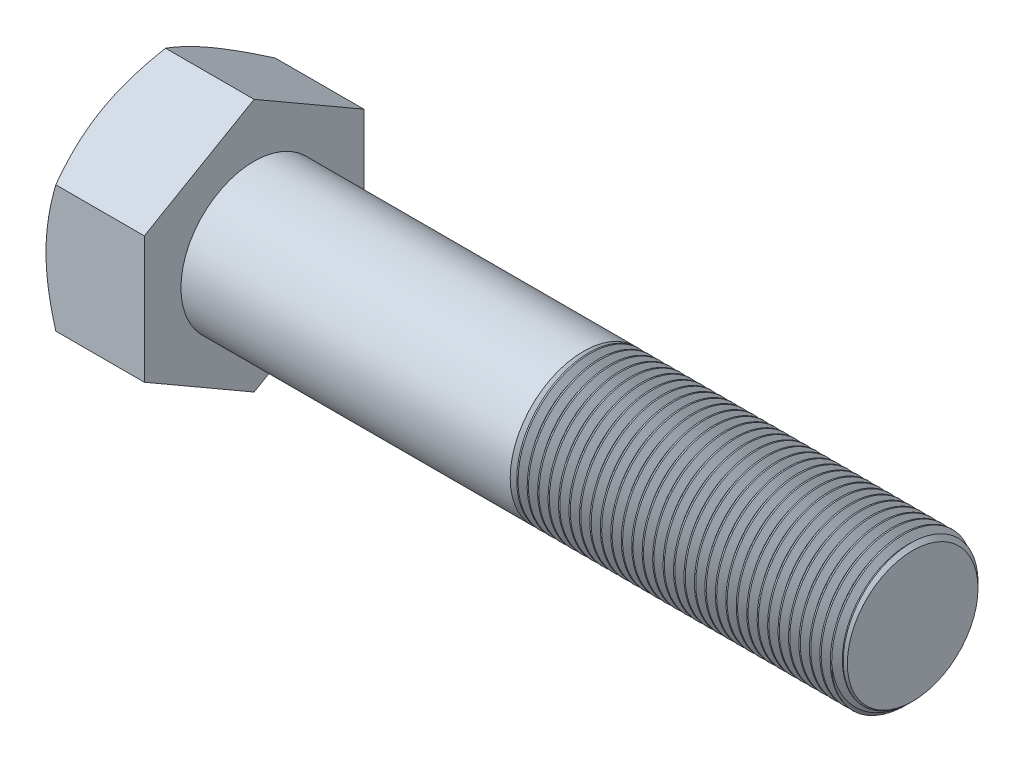
from build123d import *

# Parameters (mm, degrees)
SKETCH5_R           = 12.7
BOSS_EXTRUDE3_DEPTH = 114.3
CHAMFER1_SIZE       = 1.360714286
CUT_SWEEP1_PITCH    = 1.814285714
BOSS_EXTRUDE4_DEPTH = 17.065625
SKETCH8_OUTSIDE_W   = 538.394
SKETCH8_OUTSIDE_H   = 544.288
SKETCH8_OUTSIDE_R   = 19.05
CUT_EXTRUDE3_DEPTH  = 135.549990553
CUT_EXTRUDE3_DRAFT  = -60
CUT_EXTRUDE4_DEPTH  = 0.254
CIRPATTERN1_COUNT   = 3


with BuildPart() as part:
    # Sketch5 → Boss-Extrude3 (new body)
    with BuildSketch(Plane(origin=(65.6828125, 0, 0), x_dir=(0, 0, -1), z_dir=(1, 0, 0))):
        Circle(SKETCH5_R)
    extrude(amount=-BOSS_EXTRUDE3_DEPTH)

    # Chamfer1
    chamfer1_edges = [part.edges().sort_by_distance(p)[0] for p in [
        (65.6828125, 0, 12.7),
    ]]
    chamfer(chamfer1_edges, length=CHAMFER1_SIZE)

    # Cut-Sweep1: arcs per turn and ends read off the stored shape
    # Cut-Sweep1: the profile of Sketch10 profile screwed along a right-hand helix through 32.5 turns, 10 arcs to a turn; built about Z, then put on its axis
    cut_sweep1_z = Axis((0, 0, 0), (0, 0, 1))
    cut_sweep1_corners = [(12.7003, 0, 0.000173205), (11.521586861, 0, -0.680357143), (11.521586861, 0, -0.907142857), (12.7003, 0, -1.587673205)]
    with BuildLine(mode=Mode.PRIVATE) as cut_sweep1_profile:
        Line(cut_sweep1_corners[0], cut_sweep1_corners[1])
        Line(cut_sweep1_corners[1], cut_sweep1_corners[2])
        Line(cut_sweep1_corners[2], cut_sweep1_corners[3])
        Line(cut_sweep1_corners[3], cut_sweep1_corners[0])
    cut_sweep1_cap = Face(cut_sweep1_profile.wire())
    cut_sweep1_turn_angles = [0, 18, 36, 54, 72, 90, 108, 126, 144, 162, 180, 198, 216, 234, 252, 270, 288, 306, 324, 342, 360]
    cut_sweep1_turn_weights = [1, 0.9510565162951535, 1, 0.9510565162951535, 1, 0.9510565162951535, 1, 0.9510565162951535, 1, 0.9510565162951535, 1, 0.9510565162951535, 1, 0.9510565162951535, 1, 0.9510565162951535, 1, 0.9510565162951535, 1, 0.9510565162951535, 1]
    cut_sweep1_turn_rails = [Edge.make_bspline([Vector(p[0], p[1], 0).rotate(cut_sweep1_z, cut_sweep1_turn_angles[k]) / cut_sweep1_turn_weights[k] + Vector(0, 0, p[2] + CUT_SWEEP1_PITCH * cut_sweep1_turn_angles[k] / 360) for k in range(21)], [0, 0, 0, 1, 1, 2, 2, 3, 3, 4, 4, 5, 5, 6, 6, 7, 7, 8, 8, 9, 9, 10, 10, 10], 2, cut_sweep1_turn_weights) for p in cut_sweep1_corners]
    cut_sweep1_turn_sides = [Face.make_surface_from_curves(cut_sweep1_turn_rails[p[0]], cut_sweep1_turn_rails[p[1]]) for p in [(0, 1), (1, 2), (2, 3), (3, 0)]]
    cut_sweep1_last_angles = [11520, 11538, 11556, 11574, 11592, 11610, 11628, 11646, 11664, 11682, 11700]
    cut_sweep1_last_weights = [1, 0.9510565162951535, 1, 0.9510565162951535, 1, 0.9510565162951535, 1, 0.9510565162951535, 1, 0.9510565162953007, 1]
    cut_sweep1_last_rails = [Edge.make_bspline([Vector(p[0], p[1], 0).rotate(cut_sweep1_z, cut_sweep1_last_angles[k]) / cut_sweep1_last_weights[k] + Vector(0, 0, p[2] + CUT_SWEEP1_PITCH * cut_sweep1_last_angles[k] / 360) for k in range(11)], [0, 0, 0, 1, 1, 2, 2, 3, 3, 4, 4, 5, 5, 5], 2, cut_sweep1_last_weights) for p in cut_sweep1_corners]
    cut_sweep1_last_sides = [Face.make_surface_from_curves(cut_sweep1_last_rails[p[0]], cut_sweep1_last_rails[p[1]]) for p in [(0, 1), (1, 2), (2, 3), (3, 0)]]
    cut_sweep1 = Plane(origin=(65.6828125, 0, 0), x_dir=(0, 1, 0), z_dir=(-1, 0, 0)) * Solid(Shell([*[p.moved(Location((0, 0, CUT_SWEEP1_PITCH * i))) for i in range(32) for p in cut_sweep1_turn_sides], *cut_sweep1_last_sides, cut_sweep1_cap, cut_sweep1_cap.rotate(cut_sweep1_z, 11700).moved(Location((0, 0, CUT_SWEEP1_PITCH * 11700 / 360)))]))
    add(cut_sweep1, mode=Mode.SUBTRACT)

    # Sketch11 → Revolve1 (revolve)
    with BuildSketch(Plane.XY, mode=Mode.PRIVATE) as revolve1_sk:
        Polygon((-48.6171875, 12.7), (-48.6171875, 0), (21.2328125, 0), (8.5328125, 12.7), align=None)
    revolve(revolve1_sk.sketch.rotate(Axis((-48.6171875, 0, 0), (1, 0, 0)), 270), axis=Axis((-48.6171875, 0, 0), (1, 0, 0)))

    # Sketch6 → Boss-Extrude4 (add)
    with BuildSketch(Plane.ZY.offset(48.6171875)):
        Polygon((19.05, 10.998522628), (0, 21.997045256), (-19.05, 10.998522628), (-19.05, -10.998522628), (0, -21.997045256), (19.05, -10.998522628), align=None)
    extrude(amount=BOSS_EXTRUDE4_DEPTH)


with BuildPart() as cut_extrude3_tool:
    # Sketch8 outside → Cut-Extrude3 (with draft: the straight prism first)
    with BuildSketch(Plane.ZY.offset(65.6828125)):
        Rectangle(SKETCH8_OUTSIDE_W, SKETCH8_OUTSIDE_H)
        Circle(SKETCH8_OUTSIDE_R, mode=Mode.SUBTRACT)
    extrude(amount=-CUT_EXTRUDE3_DEPTH)
    # Cut-Extrude3: the draft: its side faces are tilted about the plane it starts from
    cut_extrude3_sides = [cut_extrude3_tool.faces().sort_by_distance(p)[0] for p in [
        (2.092182777, -272.144, 0),
        (2.092182777, 0, 269.197),
        (2.092182777, 272.144, 0),
        (2.092182777, 0, -269.197),
        (2.092182777, 0, -19.05),
    ]]
    draft(cut_extrude3_sides, Plane.ZY.offset(65.6828125), CUT_EXTRUDE3_DRAFT)


with BuildPart() as part_1:
    add(part.part)

    # Cut-Extrude3: cut by cut_extrude3_tool
    add(cut_extrude3_tool.part, mode=Mode.SUBTRACT)

    # Sketch12 → Cut-Extrude4 (cut)
    with BuildSketch(Plane.ZY.offset(65.6828125)):
        with BuildLine():
            Line((0.5715, 14.6685), (0.5715, 8.1915))
            ThreePointArc((0.5715, 8.1915), (0, 7.62), (-0.5715, 8.1915))
            Line((-0.5715, 8.1915), (-0.5715, 14.6685))
            ThreePointArc((-0.5715, 14.6685), (0, 15.24), (0.5715, 14.6685))
        make_face()
    cut_extrude4 = extrude(amount=-CUT_EXTRUDE4_DEPTH, mode=Mode.SUBTRACT)

    # CirPattern1: Cut-Extrude4 ×3 about axis
    cirpattern1_axis = Axis((0, 0, 0), (1, 0, 0))
    for i in range(1, CIRPATTERN1_COUNT):
        add(cut_extrude4.rotate(cirpattern1_axis, i * 360 / CIRPATTERN1_COUNT), mode=Mode.SUBTRACT)


solid = part_1.part
